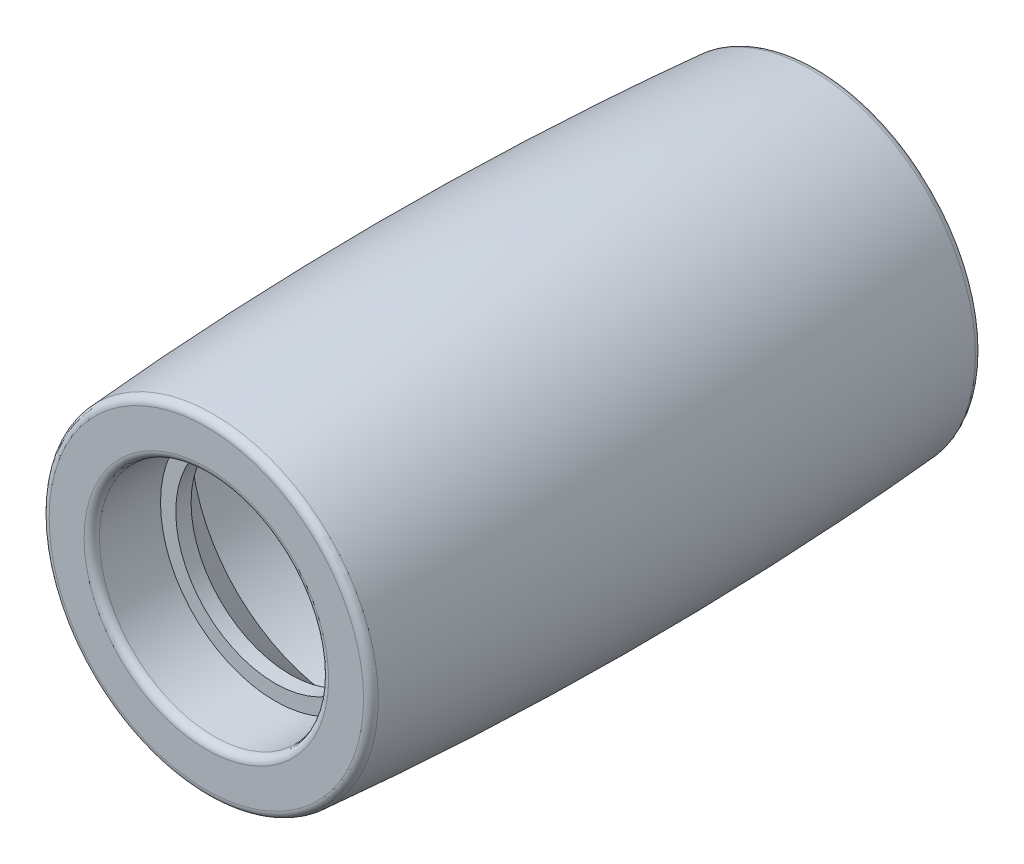
from build123d import *

# Parameters (mm, degrees)
VERRUNDUNG1_R = 1


with BuildPart() as part:
    # Skizze1 → Rotation1 (revolve)
    with BuildSketch(Plane(origin=(450, 0, 0), x_dir=(0, 0, -1), z_dir=(1, 0, 0))):
        with BuildLine():
            Line((28.212088496, 20.212088496), (50, 20.212088496))
            Line((50, 20.212088496), (50, 23))
            ThreePointArc((50, 23), (29.98594244, 22.624868257), (10, 21.5))
            Line((10, 21.5), (10, 15))
            Line((10, 15), (19, 15))
            Line((19, 15), (19, 13))
            Line((19, 13), (21, 13))
            Line((21, 13), (28.212088496, 20.212088496))
        make_face()
    revolve(axis=Axis((450, 0, 0), (0, 0, -1)))

    # Spiegeln1: part across plane


with BuildPart() as part_1:
    add(part.part)
    add(part.part.mirror(Plane(origin=(450, 23, -50), x_dir=(1, 0, 0), z_dir=(0, 0, 1))))

    # Verrundung1
    verrundung1_edges = [part_1.edges().sort_by_distance(p)[0] for p in [
        (450, -21.5, -10),
        (450, -15, -10),
        (450, -21.5, -90),
        (450, -15, -90),
    ]]
    fillet(verrundung1_edges, radius=VERRUNDUNG1_R)


solid = part_1.part
